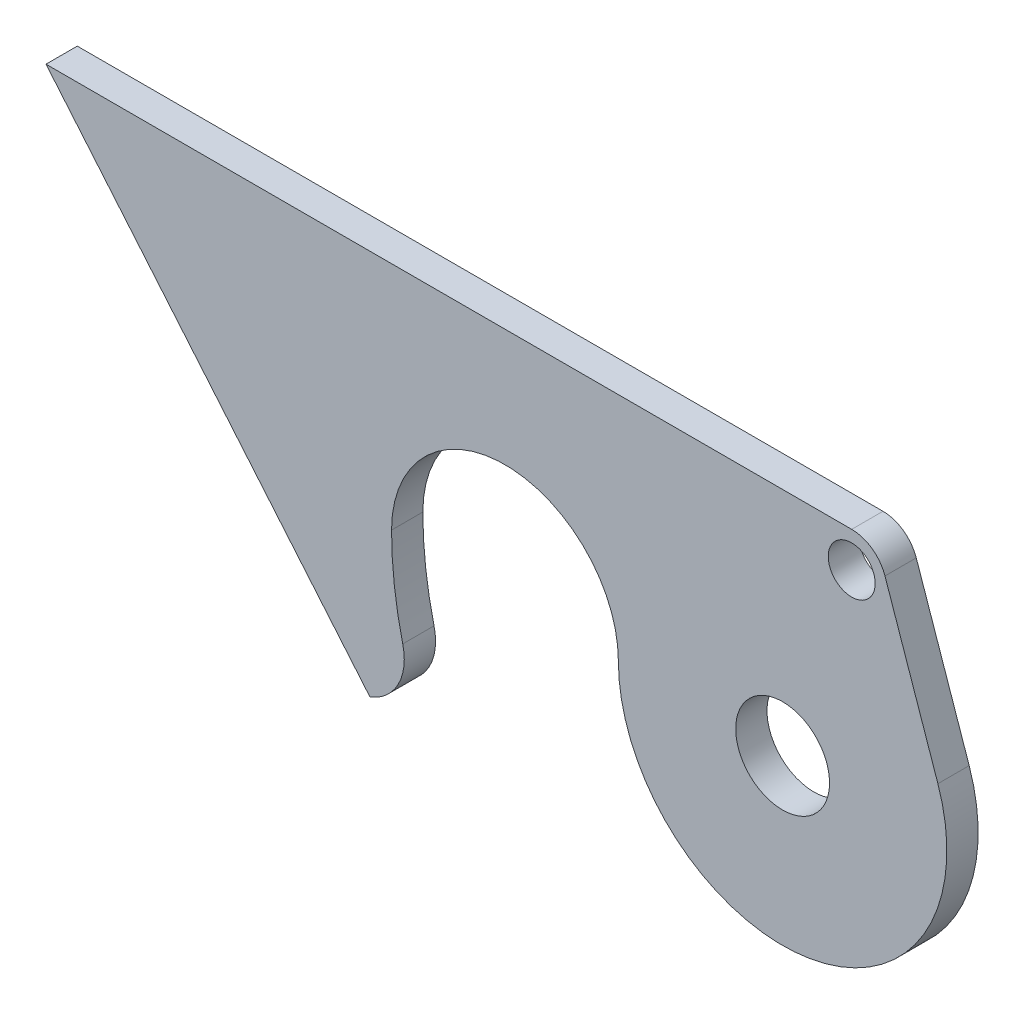
from build123d import *

# Parameters (mm, degrees)
SKETCH_1_R             = 6
SKETCH_1_R_2           = 3
SM_BASE_FLANGE_1_DEPTH = 4


# Sheet-metal steps are written as plain solids
with BuildPart() as part:
    # Sketch 1 → Базовая кромка1 (new body)
    with BuildSketch(Plane.XY):
        with BuildLine():
            Line((-94.18015229, 29.5), (0, 29.5))
            Line((0, 29.5), (8.832749987, 29.5))
            ThreePointArc((8.832749987, 29.5), (11.445095498, 28.664103019), (13.086929131, 26.466955969))
            Line((13.086929131, 26.466955969), (19.852836003, 6.845794522))
            ThreePointArc((19.852836003, 6.845794522), (3.470622706, -20.71122348), (-21, 0))
            ThreePointArc((-21, 0), (-35.5, 14.5), (-50, 0))
            ThreePointArc((-50, 0), (-49.640340933, -5.986363846), (-48.566537916, -11.88660569))
            ThreePointArc((-48.566537916, -11.88660569), (-49.156122287, -16.666789945), (-52.76892738, -19.85197606))
            Line((-52.76892738, -19.85197606), (-94.18015229, 29.5))
        make_face()
        Circle(SKETCH_1_R, mode=Mode.SUBTRACT)
        with Locations((8.832749987, 25)):
            Circle(SKETCH_1_R_2, mode=Mode.SUBTRACT)
    extrude(amount=-SM_BASE_FLANGE_1_DEPTH)


solid = part.part
